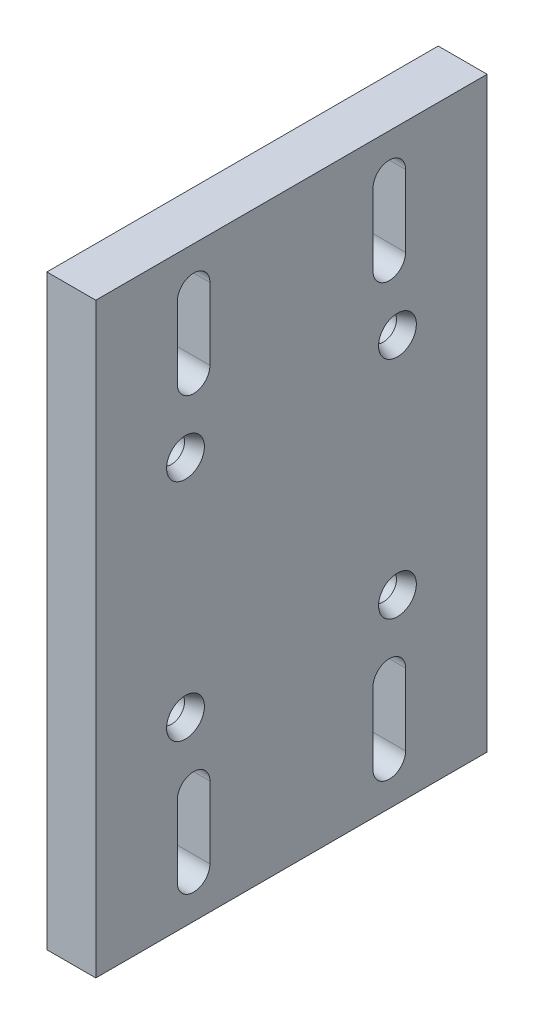
from build123d import *

# Parameters (mm, degrees)
SKETCH1_W                         = 76.2
SKETCH1_H                         = 114.3
BOSS_EXTRUDE1_DEPTH               = 9.525
F_1_4_20_TAPPED_HOLE1_D           = 5.1054
F_1_4_20_TAPPED_HOLE1_CSINK_D     = 7.366
F_1_4_20_TAPPED_HOLE1_CSINK_ANGLE = 45
CUT_EXTRUDE1_DEPTH                = 70.343046695


with BuildPart() as part:
    # Sketch1 → Boss-Extrude1 (new body)
    with BuildSketch(Plane(origin=(0, 0, 0), x_dir=(0, 0, -1), z_dir=(1, 0, 0))):
        Rectangle(SKETCH1_W, SKETCH1_H)
    extrude(amount=BOSS_EXTRUDE1_DEPTH)

    # 1/4-20 Tapped Hole1 (through all)
    with Locations(Plane(origin=(9.525, 0, 0), x_dir=(0, 0, -1), z_dir=(1, 0, 0))):
        with Locations((-20.6375, 21.9075), (20.6375, 21.9075), (20.6375, -21.9075), (-20.6375, -21.9075)):
            CounterSinkHole(F_1_4_20_TAPPED_HOLE1_D / 2, F_1_4_20_TAPPED_HOLE1_CSINK_D / 2, counter_sink_angle=F_1_4_20_TAPPED_HOLE1_CSINK_ANGLE)

    # Sketch4 → Cut-Extrude1 (cut, through all)
    with BuildSketch(Plane(origin=(9.525, 0, 0), x_dir=(0, 0, -1), z_dir=(1, 0, 0))):
        with BuildLine():
            Line((15.875, 49.022), (15.875, 35.052))
            ThreePointArc((15.875, 35.052), (19.05, 31.877), (22.225, 35.052))
            Line((22.225, 35.052), (22.225, 49.022))
            ThreePointArc((22.225, 49.022), (19.05, 52.197), (15.875, 49.022))
        make_face()
        with BuildLine():
            Line((-22.225, 49.022), (-22.225, 35.052))
            ThreePointArc((-22.225, 35.052), (-19.05, 31.877), (-15.875, 35.052))
            Line((-15.875, 35.052), (-15.875, 49.022))
            ThreePointArc((-15.875, 49.022), (-19.05, 52.197), (-22.225, 49.022))
        make_face()
        with BuildLine():
            Line((-15.875, -49.022), (-15.875, -35.052))
            ThreePointArc((-15.875, -35.052), (-19.05, -31.877), (-22.225, -35.052))
            Line((-22.225, -35.052), (-22.225, -49.022))
            ThreePointArc((-22.225, -49.022), (-19.05, -52.197), (-15.875, -49.022))
        make_face()
        with BuildLine():
            Line((22.225, -49.022), (22.225, -35.052))
            ThreePointArc((22.225, -35.052), (19.05, -31.877), (15.875, -35.052))
            Line((15.875, -35.052), (15.875, -49.022))
            ThreePointArc((15.875, -49.022), (19.05, -52.197), (22.225, -49.022))
        make_face()
    extrude(amount=-CUT_EXTRUDE1_DEPTH, mode=Mode.SUBTRACT)


solid = part.part
